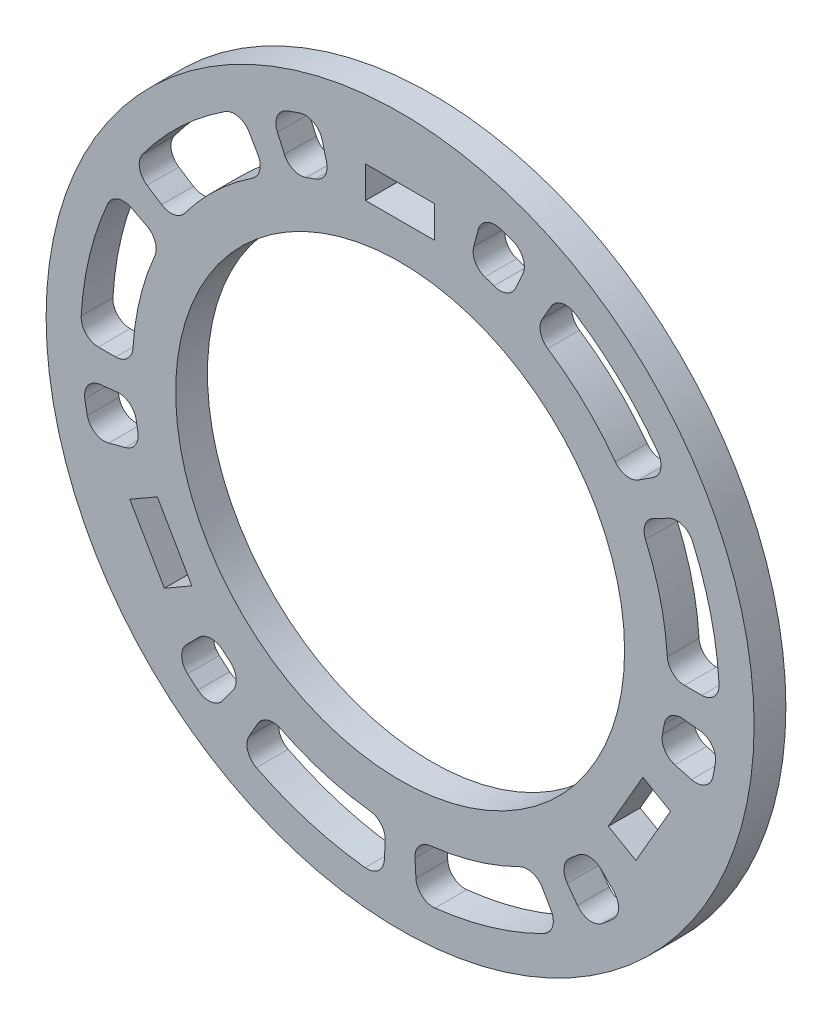
from build123d import *

# Parameters (mm, degrees)
SKETCH1_R           = 65.0875
SKETCH1_R_2         = 41.275
SKETCH1_W           = 12.7
SKETCH1_H           = 5.842
BOSS_EXTRUDE1_DEPTH = 5.842
CUT_EXTRUDE2_DEPTH  = 93.232826458
FILLET1_R           = 3.175


with BuildPart() as part:
    # Sketch1 → Boss-Extrude1 (new body)
    with BuildSketch(Plane.XY):
        Circle(SKETCH1_R)
        Circle(SKETCH1_R_2, mode=Mode.SUBTRACT)
        with Locations((0, 50.8)):
            Rectangle(SKETCH1_W, SKETCH1_H, mode=Mode.SUBTRACT)
        Polygon((49.698750717, -21.361238686), (44.639430308, -18.440238686), (38.289430308, -29.438761314), (43.348750717, -32.359761314), align=None, mode=Mode.SUBTRACT)
        Polygon((-43.348750717, -32.359761314), (-38.289430308, -29.438761314), (-44.639430308, -18.440238686), (-49.698750717, -21.361238686), align=None, mode=Mode.SUBTRACT)
    extrude(amount=BOSS_EXTRUDE1_DEPTH)

    # Sketch3 → Cut-Extrude2 (cut, through all)
    with BuildSketch(Plane.XY.offset(5.842)):
        with BuildLine():
            ThreePointArc((-41.273075325, 26.803048511), (-33.875649556, 35.697486233), (-24.60625, 42.619275184))
            Line((-24.60625, 42.619275184), (-29.36875, 50.868167155))
            ThreePointArc((-29.36875, 50.868167155), (-40.43222689, 42.606677117), (-49.261412485, 31.990735319))
            Line((-49.261412485, 31.990735319), (-41.273075325, 26.803048511))
        make_face()
        with BuildLine():
            Line((-58.7375, 0), (-49.2125, 0))
            ThreePointArc((-49.2125, 0), (-47.852754708, 11.488429969), (-43.848658572, 22.342007468))
            Line((-43.848658572, 22.342007468), (-52.335495715, 26.666266978))
            ThreePointArc((-52.335495715, 26.666266978), (-57.114578199, 13.711997059), (-58.7375, 0))
        make_face()
        with BuildLine():
            Line((52.335495715, 26.666266978), (43.848658572, 22.342007468))
            ThreePointArc((43.848658572, 22.342007468), (47.852754708, 11.488429969), (49.2125, 0))
            Line((49.2125, 0), (58.7375, 0))
            ThreePointArc((58.7375, 0), (57.114578199, 13.711997059), (52.335495715, 26.666266978))
        make_face()
        with BuildLine():
            ThreePointArc((24.60625, 42.619275184), (33.875649556, 35.697486233), (41.273075325, 26.803048511))
            Line((41.273075325, 26.803048511), (49.261412485, 31.990735319))
            ThreePointArc((49.261412485, 31.990735319), (40.43222689, 42.606677117), (29.36875, 50.868167155))
            Line((29.36875, 50.868167155), (24.60625, 42.619275184))
        make_face()
        with BuildLine():
            Line((-3.07408323, -58.657002298), (-2.575583247, -49.145055979))
            ThreePointArc((-2.575583247, -49.145055979), (-13.977105151, -47.185916202), (-24.60625, -42.619275184))
            Line((-24.60625, -42.619275184), (-29.36875, -50.868167155))
            ThreePointArc((-29.36875, -50.868167155), (-16.68235131, -56.318674177), (-3.07408323, -58.657002298))
        make_face()
        with BuildLine():
            ThreePointArc((24.60625, -42.619275184), (13.977105151, -47.185916202), (2.575583247, -49.145055979))
            Line((2.575583247, -49.145055979), (3.07408323, -58.657002298))
            ThreePointArc((3.07408323, -58.657002298), (16.68235131, -56.318674177), (29.36875, -50.868167155))
            Line((29.36875, -50.868167155), (24.60625, -42.619275184))
        make_face()
        with BuildLine():
            Line((-23.890693573, 53.659376318), (-20.016527047, 44.957855834))
            ThreePointArc((-20.016527047, 44.957855834), (-16.42747006, 46.38974438), (-12.737132257, 47.535624726))
            Line((-12.737132257, 47.535624726), (-15.202383662, 56.736068222))
            ThreePointArc((-15.202383662, 56.736068222), (-19.606980394, 55.368404583), (-23.890693573, 53.659376318))
        make_face()
        with BuildLine():
            ThreePointArc((-58.415729829, -6.139740611), (-57.753935133, -10.704059179), (-56.736068222, -15.202383662))
            Line((-56.736068222, -15.202383662), (-47.535624726, -12.737132257))
            ThreePointArc((-47.535624726, -12.737132257), (-48.388432138, -8.968265798), (-48.942908776, -5.144106999))
            Line((-48.942908776, -5.144106999), (-58.415729829, -6.139740611))
        make_face()
        with BuildLine():
            Line((58.415729829, -6.139740611), (48.942908776, -5.144106999))
            ThreePointArc((48.942908776, -5.144106999), (48.388432138, -8.968265798), (47.535624726, -12.737132257))
            Line((47.535624726, -12.737132257), (56.736068222, -15.202383662))
            ThreePointArc((56.736068222, -15.202383662), (57.753935133, -10.704059179), (58.415729829, -6.139740611))
        make_face()
        with BuildLine():
            ThreePointArc((23.890693573, 53.659376318), (19.606980394, 55.368404583), (15.202383662, 56.736068222))
            Line((15.202383662, 56.736068222), (12.737132257, 47.535624726))
            ThreePointArc((12.737132257, 47.535624726), (16.42747006, 46.38974438), (20.016527047, 44.957855834))
            Line((20.016527047, 44.957855834), (23.890693573, 53.659376318))
        make_face()
        with BuildLine():
            Line((-34.525036257, -47.519635707), (-28.926381728, -39.813748836))
            ThreePointArc((-28.926381728, -39.813748836), (-31.960962078, -37.421478582), (-34.798492469, -34.798492469))
            Line((-34.798492469, -34.798492469), (-41.53368456, -41.53368456))
            ThreePointArc((-41.53368456, -41.53368456), (-38.146954739, -44.664345404), (-34.525036257, -47.519635707))
        make_face()
        with BuildLine():
            ThreePointArc((34.525036257, -47.519635707), (38.146954739, -44.664345404), (41.53368456, -41.53368456))
            Line((41.53368456, -41.53368456), (34.798492469, -34.798492469))
            ThreePointArc((34.798492469, -34.798492469), (31.960962078, -37.421478582), (28.926381728, -39.813748836))
            Line((28.926381728, -39.813748836), (34.525036257, -47.519635707))
        make_face()
    extrude(amount=-CUT_EXTRUDE2_DEPTH, mode=Mode.SUBTRACT)

    # Fillet1
    fillet1_edges = [part.edges().sort_by_distance(p)[0] for p in [
        (-52.335495715, 26.666266978, 2.921),
        (-58.415729829, -6.139740611, 2.921),
        (-43.848658572, 22.342007468, 2.921),
        (-48.942908776, -5.144106999, 2.921),
        (-58.7375, 0, 2.921),
        (-56.736068222, -15.202383662, 2.921),
        (-47.535624726, -12.737132257, 2.921),
        (-49.2125, 0, 2.921),
        (-41.273075325, 26.803048511, 2.921),
        (-49.261412485, 31.990735319, 2.921),
        (-20.016527047, 44.957855834, 2.921),
        (-12.737132257, 47.535624726, 2.921),
        (-15.202383662, 56.736068222, 2.921),
        (-23.890693573, 53.659376318, 2.921),
        (-29.36875, 50.868167155, 2.921),
        (-24.60625, 42.619275184, 2.921),
        (41.53368456, -41.53368456, 2.921),
        (34.525036257, -47.519635707, 2.921),
        (34.798492469, -34.798492469, 2.921),
        (28.926381728, -39.813748836, 2.921),
        (3.07408323, -58.657002298, 2.921),
        (2.575583247, -49.145055979, 2.921),
        (24.60625, -42.619275184, 2.921),
        (29.36875, -50.868167155, 2.921),
        (-3.07408323, -58.657002298, 2.921),
        (-2.575583247, -49.145055979, 2.921),
        (-29.36875, -50.868167155, 2.921),
        (-24.60625, -42.619275184, 2.921),
        (-28.926381728, -39.813748836, 2.921),
        (-41.53368456, -41.53368456, 2.921),
        (-34.798492469, -34.798492469, 2.921),
        (-34.525036257, -47.519635707, 2.921),
        (48.942908776, -5.144106999, 2.921),
        (58.415729829, -6.139740611, 2.921),
        (56.736068222, -15.202383662, 2.921),
        (47.535624726, -12.737132257, 2.921),
        (58.7375, 0, 2.921),
        (49.2125, 0, 2.921),
        (52.335495715, 26.666266978, 2.921),
        (43.848658572, 22.342007468, 2.921),
        (49.261412485, 31.990735319, 2.921),
        (41.273075325, 26.803048511, 2.921),
        (29.36875, 50.868167155, 2.921),
        (23.890693573, 53.659376318, 2.921),
        (15.202383662, 56.736068222, 2.921),
        (24.60625, 42.619275184, 2.921),
        (12.737132257, 47.535624726, 2.921),
        (20.016527047, 44.957855834, 2.921),
    ]]
    fillet(fillet1_edges, radius=FILLET1_R)


solid = part.part
